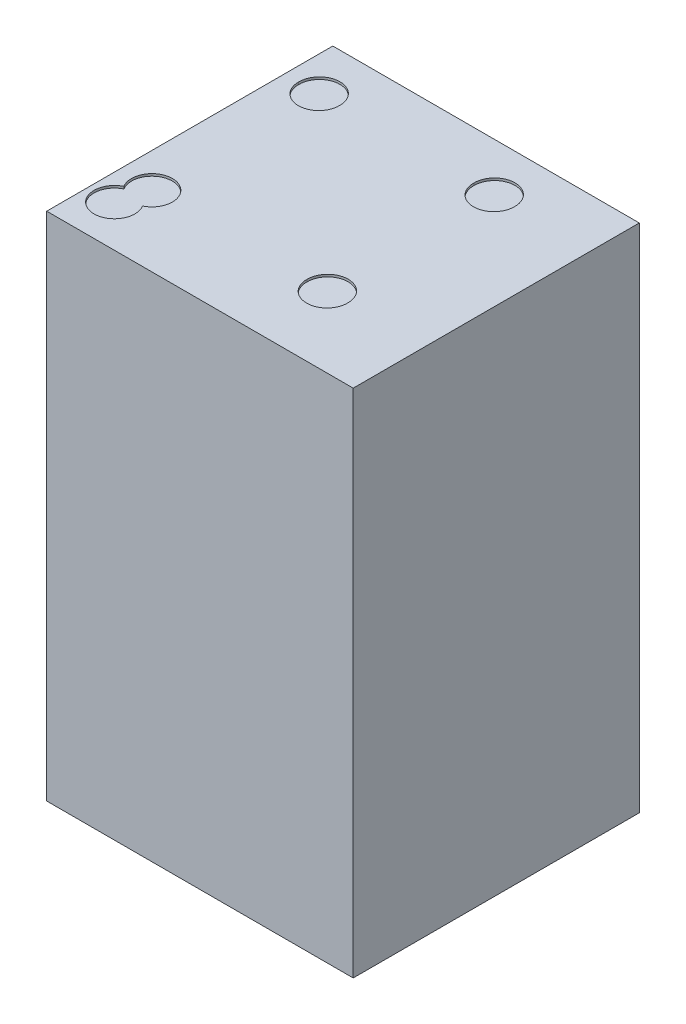
from build123d import *

# Parameters (mm, degrees)
CROQUIS1_W                            = 45
CROQUIS1_H                            = 42
SALIENTE_EXTRUIR1_DEPTH               = 75
CROQUIS3_W                            = 3
CROQUIS3_H                            = 1
TALADRO_DE_MARGEN_PARA_M61_AT_2_COUNT = 2
TALADRO_DE_MARGEN_PARA_M61_AT_2_PITCH = 25.702920672
TALADRO_DE_MARGEN_PARA_M61_AT_3_COUNT = 2
TALADRO_DE_MARGEN_PARA_M61_AT_3_PITCH = 35.509059169
TALADRO_DE_MARGEN_PARA_M61_AT_4_COUNT = 2
TALADRO_DE_MARGEN_PARA_M61_AT_4_PITCH = 24.500064327
TALADRO_START                         = -0.333644058
TALADRO_DE_MARGEN_PARA_M62_DEPTH      = 0.333644058


# Read off the part's stored shape, not the designer's step: Taladro de margen para M62
with BuildPart() as part:
    # Croquis1 → Saliente-Extruir1 (new body)
    with BuildSketch(Plane(origin=(0, 0, 0), x_dir=(1, 0, 0), z_dir=(0, 1, 0))):
        Rectangle(CROQUIS1_W, CROQUIS1_H)
    extrude(amount=-SALIENTE_EXTRUIR1_DEPTH)

    # Croquis3 → Taladro de margen para M61 (revolve, cut)
    with BuildSketch(Plane(origin=(8.271017264, -0.333644058, -13.885573428), x_dir=(0, 0, -1), z_dir=(1, 0, 0))):
        with Locations((1.5, 0.5)):
            Rectangle(CROQUIS3_W, CROQUIS3_H)
    taladro_de_margen_para_m61 = revolve(axis=Axis((8.271017264, -6.683644058, -13.885573428), (0, 1, 0)), mode=Mode.SUBTRACT)

    # Taladro de margen para M61 at 2: Taladro de margen para M61 ×2
    with Locations(*[(-i * TALADRO_DE_MARGEN_PARA_M61_AT_2_PITCH, 0, 0) for i in range(1, TALADRO_DE_MARGEN_PARA_M61_AT_2_COUNT)]):
        add(taladro_de_margen_para_m61, mode=Mode.SUBTRACT)

    # Taladro de margen para M61 at 3: Taladro de margen para M61 ×2
    with Locations(*[Vector(-0.7238412189178528, 0, 0.6899665859992912) * (i * TALADRO_DE_MARGEN_PARA_M61_AT_3_PITCH) for i in range(1, TALADRO_DE_MARGEN_PARA_M61_AT_3_COUNT)]):
        add(taladro_de_margen_para_m61, mode=Mode.SUBTRACT)

    # Taladro de margen para M61 at 4: Taladro de margen para M61 ×2
    with Locations(*[(0, 0, i * TALADRO_DE_MARGEN_PARA_M61_AT_4_PITCH) for i in range(1, TALADRO_DE_MARGEN_PARA_M61_AT_4_COUNT)]):
        add(taladro_de_margen_para_m61, mode=Mode.SUBTRACT)

    # Taladro de margen para M62 outline → Taladro de margen para M62 (cut)
    with BuildSketch(Plane(origin=(0, 0, 0), x_dir=(1, 0, 0), z_dir=(0, 1, 0)).offset(TALADRO_START)):
        with BuildLine():
            ThreePointArc((11.270633402, -10.566501054), (8.271017264, -7.518511209), (5.271401126, -10.566501054))
            ThreePointArc((5.271401126, -10.566501054), (8.271017264, -7.614490899), (11.270633402, -10.566501054))
        make_face()
        with BuildLine():
            ThreePointArc((-19.991497807, -12.179251747), (-19.51338327, -17.754461658), (-16.114164948, -13.309591147))
            ThreePointArc((-16.114164948, -13.309591147), (-18.271527332, -13.494600561), (-19.991497807, -12.179251747))
        make_face()
        with BuildLine():
            ThreePointArc((-14.43228727, 13.933563273), (-17.431903408, 16.981553118), (-20.431519546, 13.933563273))
            ThreePointArc((-20.431519546, 13.933563273), (-17.431903408, 16.885573428), (-14.43228727, 13.933563273))
        make_face()
        with BuildLine():
            ThreePointArc((11.270633402, 13.933563273), (8.271017264, 16.981553118), (5.271401126, 13.933563273))
            ThreePointArc((5.271401126, 13.933563273), (8.271017264, 16.885573428), (11.270633402, 13.933563273))
        make_face()
    extrude(amount=TALADRO_DE_MARGEN_PARA_M62_DEPTH, mode=Mode.SUBTRACT)


solid = part.part
